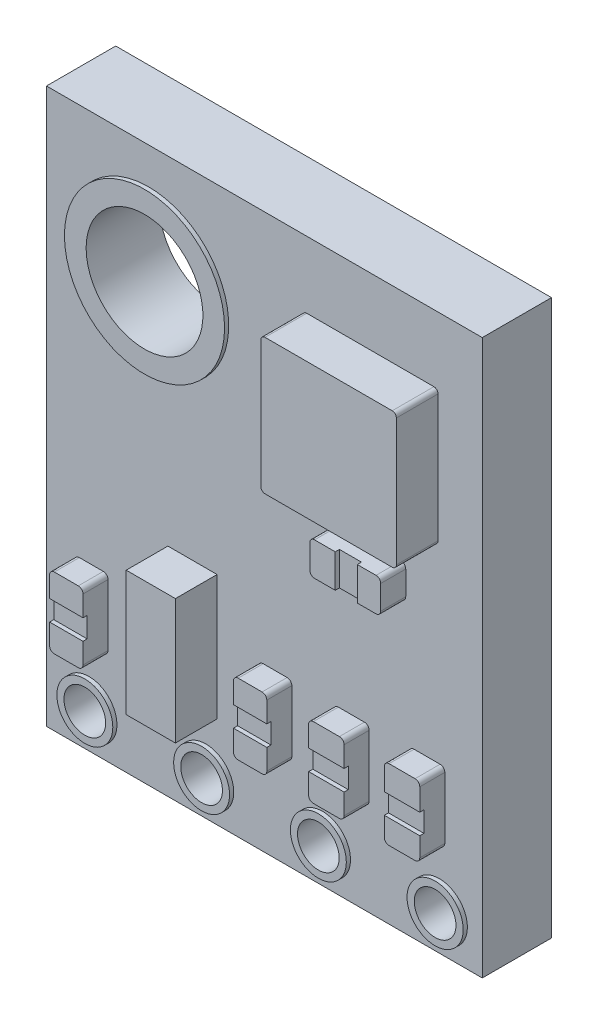
from build123d import *

# Parameters (mm, degrees)
CROQUIS1_W              = 10.45
CROQUIS1_H              = 13.3
CROQUIS1_R              = 1.4
SALIENTE_EXTRUIR1_DEPTH = 1.66
SALIENTE_EXTRUIR2_DEPTH = 1
SALIENTE_EXTRUIR3_DEPTH = 0.6
CROQUIS4_R              = 0.5
CORTAR_EXTRUIR1_DEPTH   = 2
CROQUIS5_W              = 1.18
CROQUIS5_H              = 3
SALIENTE_EXTRUIR4_DEPTH = 1
SALIENTE_EXTRUIR5_START = 0.1
CROQUIS6_R              = 0.670494612
CROQUIS6_R_2            = 0.5
CROQUIS6_R_3            = 0.673168706
CROQUIS6_R_4            = 1.920139837
CROQUIS6_R_5            = 1.4
SALIENTE_EXTRUIR5_DEPTH = 0.1
CROQUIS7_W              = 0.8
CROQUIS7_H              = 0.488253232
CROQUIS7_W_2            = 0.85
CROQUIS7_W_3            = 0.528941002
CROQUIS7_H_2            = 0.8
CORTAR_EXTRUIR2_DEPTH   = 0.1


with BuildPart() as part:
    # Croquis1 → Saliente-Extruir1 (new body)
    with BuildSketch(Plane.XY):
        Rectangle(CROQUIS1_W, CROQUIS1_H)
        with Locations((-2.775, 3.86)):
            Circle(CROQUIS1_R, mode=Mode.SUBTRACT)
    extrude(amount=SALIENTE_EXTRUIR1_DEPTH)

    # Croquis2 → Saliente-Extruir2 (add)
    with BuildSketch(Plane.XY.offset(1.66)):
        with BuildLine():
            Line((1.014875741, 5.05), (4.064875741, 5.05))
            ThreePointArc((4.064875741, 5.05), (4.13558642, 5.020710678), (4.164875741, 4.95))
            Line((4.164875741, 4.95), (4.164875741, 1.9))
            ThreePointArc((4.164875741, 1.9), (4.13558642, 1.829289322), (4.064875741, 1.8))
            Line((4.064875741, 1.8), (1.014875741, 1.8))
            ThreePointArc((1.014875741, 1.8), (0.944165063, 1.829289322), (0.914875741, 1.9))
            Line((0.914875741, 1.9), (0.914875741, 4.95))
            ThreePointArc((0.914875741, 4.95), (0.944165063, 5.020710678), (1.014875741, 5.05))
        make_face()
    extrude(amount=SALIENTE_EXTRUIR2_DEPTH)

    # Croquis3 → Saliente-Extruir3 (add)
    with BuildSketch(Plane.XY.offset(1.66)):
        with BuildLine():
            Line((0.545086024, -4.450002724), (-0.029222615, -4.450002724))
            ThreePointArc((-0.029222615, -4.450002724), (-0.109016561, -4.41695099), (-0.142068295, -4.337157044))
            Line((-0.142068295, -4.337157044), (-0.142068295, -2.862848405))
            ThreePointArc((-0.142068295, -2.862848405), (-0.109016561, -2.783054459), (-0.029222615, -2.750002724))
            Line((-0.029222615, -2.750002724), (0.545086024, -2.750002724))
            ThreePointArc((0.545086024, -2.750002724), (0.62487997, -2.783054459), (0.657931705, -2.862848405))
            Line((0.657931705, -2.862848405), (0.657931705, -4.337157044))
            ThreePointArc((0.657931705, -4.337157044), (0.62487997, -4.41695099), (0.545086024, -4.450002724))
        make_face()
        with BuildLine():
            Line((-4.549824975, -4.337157044), (-4.549824975, -2.862848405))
            ThreePointArc((-4.549824975, -2.862848405), (-4.516773241, -2.783054459), (-4.436979295, -2.750002724))
            Line((-4.436979295, -2.750002724), (-3.862670656, -2.750002724))
            ThreePointArc((-3.862670656, -2.750002724), (-3.78287671, -2.783054459), (-3.749824975, -2.862848405))
            Line((-3.749824975, -2.862848405), (-3.749824975, -4.337157044))
            ThreePointArc((-3.749824975, -4.337157044), (-3.78287671, -4.41695099), (-3.862670656, -4.450002724))
            Line((-3.862670656, -4.450002724), (-4.436979295, -4.450002724))
            ThreePointArc((-4.436979295, -4.450002724), (-4.516773241, -4.41695099), (-4.549824975, -4.337157044))
        make_face()
        with BuildLine():
            Line((3.58895412, -2.716727386), (4.213262759, -2.716727386))
            ThreePointArc((4.213262759, -2.716727386), (4.293056705, -2.749779121), (4.32610844, -2.829573067))
            Line((4.32610844, -2.829573067), (4.32610844, -4.303881706))
            ThreePointArc((4.32610844, -4.303881706), (4.293056705, -4.383675652), (4.213262759, -4.416727386))
            Line((4.213262759, -4.416727386), (3.58895412, -4.416727386))
            ThreePointArc((3.58895412, -4.416727386), (3.509160174, -4.383675652), (3.47610844, -4.303881706))
            Line((3.47610844, -4.303881706), (3.47610844, -2.829573067))
            ThreePointArc((3.47610844, -2.829573067), (3.509160174, -2.749779121), (3.58895412, -2.716727386))
        make_face()
        with BuildLine():
            Line((1.661189231, -4.337157044), (1.661189231, -2.862848405))
            ThreePointArc((1.661189231, -2.862848405), (1.694240966, -2.783054459), (1.774034912, -2.750002724))
            Line((1.774034912, -2.750002724), (2.398343551, -2.750002724))
            ThreePointArc((2.398343551, -2.750002724), (2.478137497, -2.783054459), (2.511189231, -2.862848405))
            Line((2.511189231, -2.862848405), (2.511189231, -4.337157044))
            ThreePointArc((2.511189231, -4.337157044), (2.478137497, -4.41695099), (2.398343551, -4.450002724))
            Line((2.398343551, -4.450002724), (1.774034912, -4.450002724))
            ThreePointArc((1.774034912, -4.450002724), (1.694240966, -4.41695099), (1.661189231, -4.337157044))
        make_face()
        with BuildLine():
            Line((1.689875741, 0.350979107), (1.689875741, 0.925287746))
            ThreePointArc((1.689875741, 0.925287746), (1.722927476, 1.005081692), (1.802721422, 1.038133426))
            Line((1.802721422, 1.038133426), (3.277030061, 1.038133426))
            ThreePointArc((3.277030061, 1.038133426), (3.356824007, 1.005081692), (3.389875741, 0.925287746))
            Line((3.389875741, 0.925287746), (3.389875741, 0.350979107))
            ThreePointArc((3.389875741, 0.350979107), (3.356824007, 0.271185161), (3.277030061, 0.238133426))
            Line((3.277030061, 0.238133426), (1.802721422, 0.238133426))
            ThreePointArc((1.802721422, 0.238133426), (1.722927476, 0.271185161), (1.689875741, 0.350979107))
        make_face()
    extrude(amount=SALIENTE_EXTRUIR3_DEPTH)

    # Croquis4 → Cortar-Extruir1 (cut)
    with BuildSketch(Plane.XY.offset(1.66)):
        with Locations((4.194245203, -5.773988592)):
            Circle(CROQUIS4_R)
        with Locations((1.394245203, -5.773988592)):
            Circle(CROQUIS4_R)
        with Locations((-1.405754797, -5.773988592)):
            Circle(CROQUIS4_R)
        with Locations((-4.205754797, -5.773988592)):
            Circle(CROQUIS4_R)
    extrude(amount=-CORTAR_EXTRUIR1_DEPTH, mode=Mode.SUBTRACT)

    # Croquis5 → Saliente-Extruir4 (add)
    with BuildSketch(Plane.XY.offset(1.66)):
        with Locations((-1.72406111, -2.950002724)):
            Rectangle(CROQUIS5_W, CROQUIS5_H)
    extrude(amount=SALIENTE_EXTRUIR4_DEPTH)

    # Croquis6 → Saliente-Extruir5 (add)
    # profile 1 of 5: a face of its own
    with BuildSketch(Plane.XY.offset(1.66).offset(SALIENTE_EXTRUIR5_START)):
        with Locations((-4.205754797, -5.773988592)):
            Circle(CROQUIS6_R)
        with Locations((-4.205754797, -5.773988592)):
            Circle(CROQUIS6_R_2, mode=Mode.SUBTRACT)
    # profile 2 of 5: a face of its own
    with BuildSketch(Plane.XY.offset(1.66).offset(SALIENTE_EXTRUIR5_START)):
        with Locations((-1.405754797, -5.773988592)):
            Circle(CROQUIS6_R)
        with Locations((-1.405754797, -5.773988592)):
            Circle(CROQUIS6_R_2, mode=Mode.SUBTRACT)
    # profile 3 of 5: a face of its own
    with BuildSketch(Plane.XY.offset(1.66).offset(SALIENTE_EXTRUIR5_START)):
        with Locations((1.394245203, -5.773988592)):
            Circle(CROQUIS6_R)
        with Locations((1.394245203, -5.773988592)):
            Circle(CROQUIS6_R_2, mode=Mode.SUBTRACT)
    # profile 4 of 5: a face of its own
    with BuildSketch(Plane.XY.offset(1.66).offset(SALIENTE_EXTRUIR5_START)):
        with Locations((4.194245203, -5.773988592)):
            Circle(CROQUIS6_R_3)
        with Locations((4.194245203, -5.773988592)):
            Circle(CROQUIS6_R_2, mode=Mode.SUBTRACT)
    # profile 5 of 5: a face of its own
    with BuildSketch(Plane.XY.offset(1.66).offset(SALIENTE_EXTRUIR5_START)):
        with Locations((-2.775, 3.86)):
            Circle(CROQUIS6_R_4)
        with Locations((-2.775, 3.86)):
            Circle(CROQUIS6_R_5, mode=Mode.SUBTRACT)
    extrude(amount=-SALIENTE_EXTRUIR5_DEPTH)

    # Croquis7 → Cortar-Extruir2 (cut)
    with BuildSketch(Plane.XY.offset(2.26)):
        with Locations((-4.149824975, -3.600867586)):
            Rectangle(CROQUIS7_W, CROQUIS7_H)
        with Locations((0.257931705, -3.600867586)):
            Rectangle(CROQUIS7_W, CROQUIS7_H)
        with Locations((2.086189231, -3.600867586)):
            Rectangle(CROQUIS7_W_2, CROQUIS7_H)
        with Locations((3.90110844, -3.600867586)):
            Rectangle(CROQUIS7_W_2, CROQUIS7_H)
        with Locations((2.563329468, 0.638133426)):
            Rectangle(CROQUIS7_W_3, CROQUIS7_H_2)
    extrude(amount=-CORTAR_EXTRUIR2_DEPTH, mode=Mode.SUBTRACT)


solid = part.part
